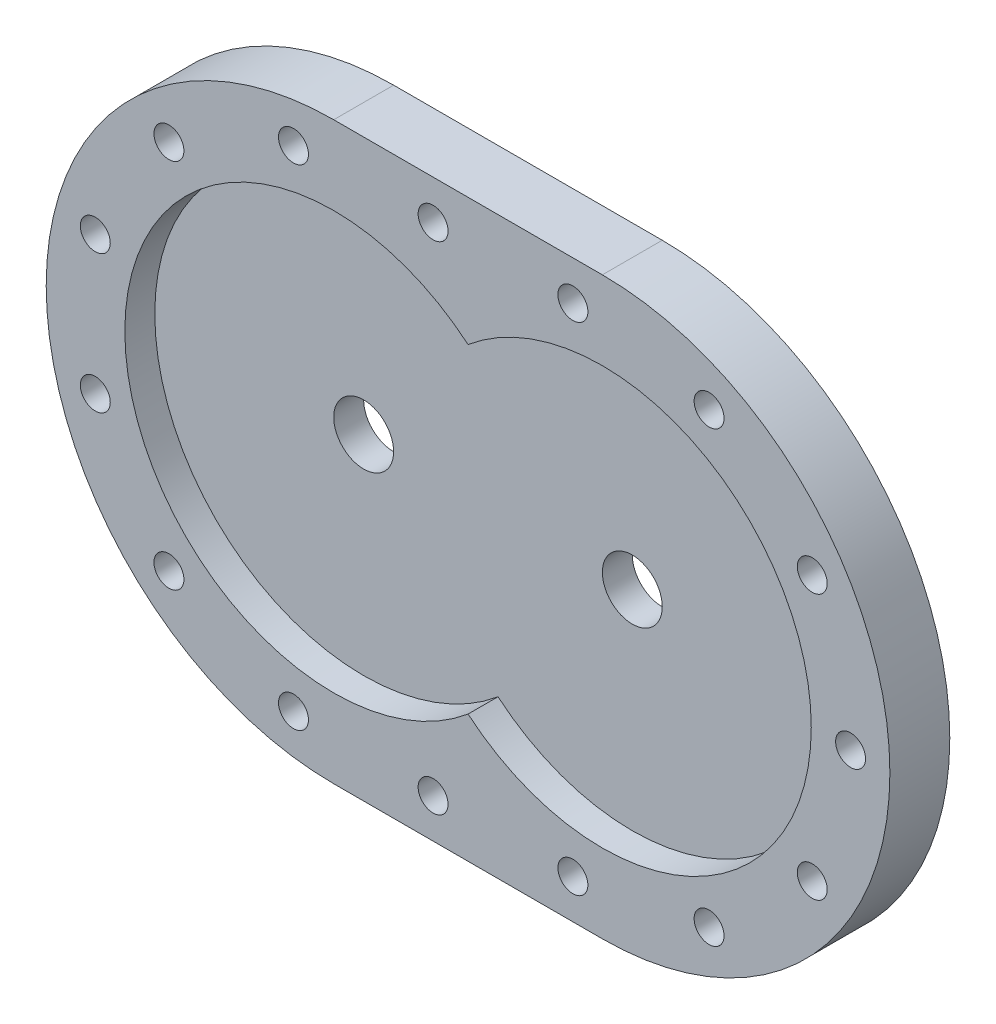
from build123d import *

# Parameters (mm, degrees)
BOSS_EXTRUDE1_DEPTH             = 20
SKETCH1_3_R                     = 10
BOSS_EXTRUDE2_DEPTH             = 10
F_1_0MM_CLEARANCE_DOWEL_HOLE1_D = 10
CRVPATTERN1_OUTLINE_R           = 5
CRVPATTERN1_DEPTH               = 20


# Read off the part's stored shape, not the designer's step: CrvPattern1
with BuildPart() as part:
    # Sketch1 → Boss-Extrude1 (new body)
    with BuildSketch(Plane.XY):
        with BuildLine():
            Line((-44.845, -96), (44.845, -96))
            ThreePointArc((44.845, -96), (140.845, 0), (44.845, 96))
            Line((44.845, 96), (-44.845, 96))
            ThreePointArc((-44.845, 96), (-140.845, 0), (-44.845, -96))
        make_face()
        with BuildLine():
            ThreePointArc((0, 53.422733691), (-114.595, 0), (0, -53.422733691))
            ThreePointArc((0, -53.422733691), (114.595, 0), (0, 53.422733691))
        make_face(mode=Mode.SUBTRACT)
    extrude(amount=BOSS_EXTRUDE1_DEPTH)

    # Sketch1<3> → Boss-Extrude2 (add)
    with BuildSketch(Plane.XY):
        with BuildLine():
            ThreePointArc((0, -53.422733691), (114.595, 0), (0, 53.422733691))
            ThreePointArc((0, 53.422733691), (-114.595, 0), (0, -53.422733691))
        make_face()
        with Locations((-44.845, 0)):
            Circle(SKETCH1_3_R, mode=Mode.SUBTRACT)
        with Locations((44.845, 0)):
            Circle(SKETCH1_3_R, mode=Mode.SUBTRACT)
    extrude(amount=BOSS_EXTRUDE2_DEPTH)

    # Ø1.0mm Clearance Dowel Hole1 (through all)
    with Locations(Plane.XY.offset(20)):
        with Locations((127.72, 0)):
            Hole(F_1_0MM_CLEARANCE_DOWEL_HOLE1_D / 2)

    # CrvPattern1 outline → CrvPattern1 (cut)
    with BuildSketch(Plane.XY):
        with Locations((114.921070285, 44.244886692)):
            Circle(CRVPATTERN1_OUTLINE_R)
        with Locations((80.477526434, 74.823717396)):
            Circle(CRVPATTERN1_OUTLINE_R)
        with Locations((35.004949117, 82.875)):
            Circle(CRVPATTERN1_OUTLINE_R)
        with Locations((-11.668316372, 82.875)):
            Circle(CRVPATTERN1_OUTLINE_R)
        with Locations((-58.282002325, 81.778435993)):
            Circle(CRVPATTERN1_OUTLINE_R)
        with Locations((-99.866296576, 61.97517687)):
            Circle(CRVPATTERN1_OUTLINE_R)
        with Locations((-124.455991546, 23.029451797)):
            Circle(CRVPATTERN1_OUTLINE_R)
        with Locations((-124.455991546, -23.029451797)):
            Circle(CRVPATTERN1_OUTLINE_R)
        with Locations((-99.866296576, -61.97517687)):
            Circle(CRVPATTERN1_OUTLINE_R)
        with Locations((-58.282002325, -81.778435993)):
            Circle(CRVPATTERN1_OUTLINE_R)
        with Locations((-11.668316372, -82.875)):
            Circle(CRVPATTERN1_OUTLINE_R)
        with Locations((35.004949117, -82.875)):
            Circle(CRVPATTERN1_OUTLINE_R)
        with Locations((80.477526434, -74.823717396)):
            Circle(CRVPATTERN1_OUTLINE_R)
        with Locations((114.921070285, -44.244886692)):
            Circle(CRVPATTERN1_OUTLINE_R)
    extrude(amount=CRVPATTERN1_DEPTH, mode=Mode.SUBTRACT)


solid = part.part
